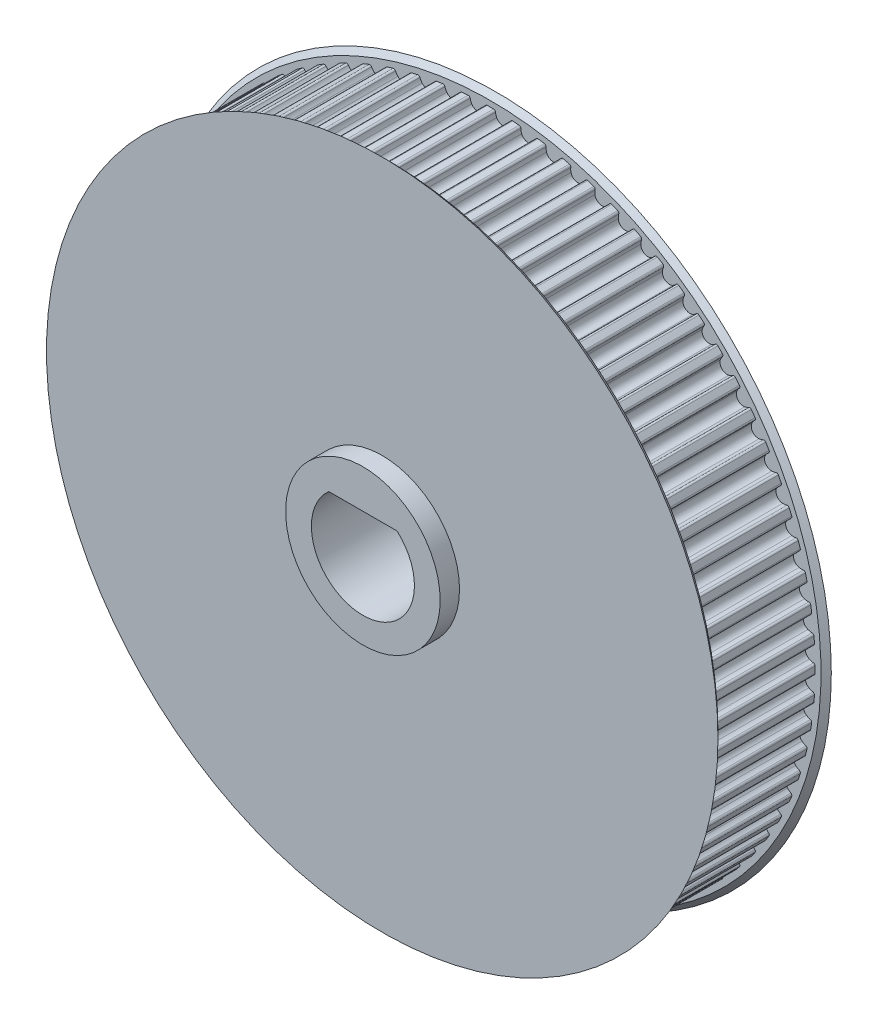
from build123d import *

# Parameters (mm, degrees)
SKETCH1_R           = 25.464790895
BOSS_EXTRUDE1_DEPTH = 4
CUT_EXTRUDE1_DEPTH  = 8
CIRPATTERN1_COUNT   = 80
SKETCH4_R           = 26.064790895
BOSS_EXTRUDE2_DEPTH = 0.4
CHAMFER1_SIZE       = 0.4
SKETCH5_R           = 4
CUT_EXTRUDE2_DEPTH  = 38.897053299
BOSS_EXTRUDE3_START = 1.5
SKETCH7_R           = 6
SKETCH7_R_2         = 4
BOSS_EXTRUDE3_DEPTH = 1.5
BOSS_EXTRUDE4_DEPTH = 10.3


with BuildPart() as part:
    # Sketch1 → Boss-Extrude1 (new, symmetric)
    with BuildSketch(Plane.XY):
        Circle(SKETCH1_R)
    extrude(amount=BOSS_EXTRUDE1_DEPTH, both=True)

    # Sketch3 → Cut-Extrude1 (cut)
    with BuildSketch(Plane.XY.offset(4)):
        with BuildLine():
            Line((0, 25.464790895), (0, 25.214790895))
            ThreePointArc((0, 25.214790895), (0.123254101, 25.21448965), (0.246505257, 25.213585922))
            ThreePointArc((0.246505257, 25.213585922), (0.345676863, 25.174822516), (0.394137591, 25.080011298))
            ThreePointArc((0.394137591, 25.080011298), (0.426427336, 24.915368977), (0.485788725, 24.758442411))
            ThreePointArc((0.485788725, 24.758442411), (0.960483183, 24.445929428), (1.458233803, 24.72023494))
            ThreePointArc((1.458233803, 24.72023494), (1.529724517, 24.872020313), (1.574832411, 25.033621673))
            ThreePointArc((1.574832411, 25.033621673), (1.630582553, 25.124338433), (1.732489788, 25.15520143))
            ThreePointArc((1.732489788, 25.15520143), (1.855431908, 25.146432198), (1.978329693, 25.137062109))
            Line((1.978329693, 25.137062109), (1.997944466, 25.386291443))
            ThreePointArc((1.997944466, 25.386291443), (0.999742999, 25.445158464), (0, 25.464790895))
        make_face()
    cut_extrude1 = extrude(amount=-CUT_EXTRUDE1_DEPTH, mode=Mode.SUBTRACT)

    # CirPattern1: Cut-Extrude1 ×80 about axis
    cirpattern1_axis = Axis((0, 0, 0), (0, 0, 1))
    for i in range(1, CIRPATTERN1_COUNT):
        add(cut_extrude1.rotate(cirpattern1_axis, i * 360 / CIRPATTERN1_COUNT), mode=Mode.SUBTRACT)

    # Sketch4 → Boss-Extrude2 (add)
    with BuildSketch(Plane.XY.offset(4)):
        Circle(SKETCH4_R)
    boss_extrude2 = extrude(amount=BOSS_EXTRUDE2_DEPTH)

    # Mirror1: Boss-Extrude2 across plane
    add(boss_extrude2.mirror(Plane.XY))

    # Chamfer1
    chamfer1_edges = [part.edges().sort_by_distance(p)[0] for p in [
        (-26.064790895, 0, 4),
        (-26.064790895, 0, -4),
    ]]
    chamfer(chamfer1_edges, length=CHAMFER1_SIZE - 0.0001)  # a hair under: the kernel refuses the full size

    # Sketch5 → Cut-Extrude2 (cut, through all)
    with BuildSketch(Plane.XY.offset(4.4)):
        Circle(SKETCH5_R)
    extrude(amount=-CUT_EXTRUDE2_DEPTH, mode=Mode.SUBTRACT)

    # Sketch7 → Boss-Extrude3 (add)
    with BuildSketch(Plane.XY.offset(4.4).offset(BOSS_EXTRUDE3_START)):
        Circle(SKETCH7_R)
        Circle(SKETCH7_R_2, mode=Mode.SUBTRACT)
    extrude(amount=-BOSS_EXTRUDE3_DEPTH)

    # Sketch8 → Boss-Extrude4 (add)
    with BuildSketch(Plane.XY.offset(5.9)):
        with BuildLine():
            ThreePointArc((2.645751311, 3), (0, 4), (-2.645751311, 3))
            Line((-2.645751311, 3), (2.645751311, 3))
        make_face()
    extrude(amount=-BOSS_EXTRUDE4_DEPTH)


solid = part.part
